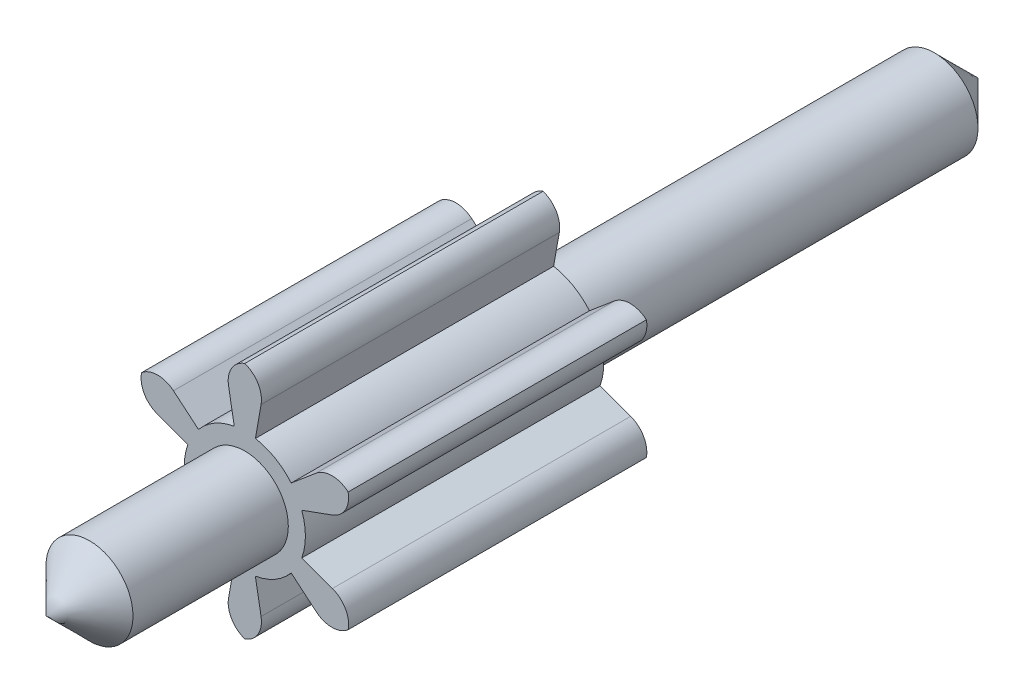
from build123d import *

# Parameters (mm, degrees)
SKETCH2_R                = 0.35
BOSS_EXTRUDE2_DEPTH      = 2.4
BOSS_EXTRUDE3_DEPTH      = 4
BOSS_EXTRUDE3_DEPTH_BACK = 3.5
SKETCH2_2_R              = 0.35
CHAMFER1_SIZE            = 0.35


with BuildPart() as part:
    # Sketch2 → Boss-Extrude2 (new body)
    with BuildSketch(Plane.XY):
        with BuildLine():
            Line((-0.084985286, 0.480035156), (-0.130746593, 0.738515625))
            ThreePointArc((-0.130746593, 0.738515625), (-0.106331255, 0.873436103), (0, 0.96))
            ThreePointArc((0, 0.96), (0.106331255, 0.873436103), (0.130746593, 0.738515625))
            Line((0.130746593, 0.738515625), (0.084985286, 0.480035156))
            ThreePointArc((0.084985286, 0.480035156), (0.24375, 0.422187384), (0.373229997, 0.313616994))
            Line((0.373229997, 0.313616994), (0.574199996, 0.482487684))
            ThreePointArc((0.574199996, 0.482487684), (0.703252226, 0.528803619), (0.831384388, 0.48))
            ThreePointArc((0.831384388, 0.48), (0.809583481, 0.344632483), (0.704946589, 0.256027941))
            Line((0.704946589, 0.256027941), (0.458215283, 0.166418162))
            ThreePointArc((0.458215283, 0.166418162), (0.4875, 0), (0.458215283, -0.166418162))
            Line((0.458215283, -0.166418162), (0.704946589, -0.256027941))
            ThreePointArc((0.704946589, -0.256027941), (0.809583481, -0.344632483), (0.831384388, -0.48))
            ThreePointArc((0.831384388, -0.48), (0.703252226, -0.528803619), (0.574199996, -0.482487684))
            Line((0.574199996, -0.482487684), (0.373229997, -0.313616994))
            ThreePointArc((0.373229997, -0.313616994), (0.24375, -0.422187384), (0.084985286, -0.480035156))
            Line((0.084985286, -0.480035156), (0.130746593, -0.738515625))
            ThreePointArc((0.130746593, -0.738515625), (0.106331255, -0.873436103), (0, -0.96))
            ThreePointArc((0, -0.96), (-0.106331255, -0.873436103), (-0.130746593, -0.738515625))
            Line((-0.130746593, -0.738515625), (-0.084985286, -0.480035156))
            ThreePointArc((-0.084985286, -0.480035156), (-0.24375, -0.422187384), (-0.373229997, -0.313616994))
            Line((-0.373229997, -0.313616994), (-0.574199996, -0.482487684))
            ThreePointArc((-0.574199996, -0.482487684), (-0.703252226, -0.528803619), (-0.831384388, -0.48))
            ThreePointArc((-0.831384388, -0.48), (-0.809583481, -0.344632483), (-0.704946589, -0.256027941))
            Line((-0.704946589, -0.256027941), (-0.458215283, -0.166418162))
            ThreePointArc((-0.458215283, -0.166418162), (-0.4875, 0), (-0.458215283, 0.166418162))
            Line((-0.458215283, 0.166418162), (-0.704946589, 0.256027941))
            ThreePointArc((-0.704946589, 0.256027941), (-0.809583481, 0.344632483), (-0.831384388, 0.48))
            ThreePointArc((-0.831384388, 0.48), (-0.703252226, 0.528803619), (-0.574199996, 0.482487684))
            Line((-0.574199996, 0.482487684), (-0.373229997, 0.313616994))
            ThreePointArc((-0.373229997, 0.313616994), (-0.24375, 0.422187384), (-0.084985286, 0.480035156))
        make_face()
        Circle(SKETCH2_R, mode=Mode.SUBTRACT)
    extrude(amount=BOSS_EXTRUDE2_DEPTH)

    # Sketch2<2> → Boss-Extrude3 (add, two sides: drawn at the far end of the back side and taken through both)
    with BuildSketch(Plane.XY.offset(-BOSS_EXTRUDE3_DEPTH_BACK)):
        Circle(SKETCH2_2_R)
    extrude(amount=BOSS_EXTRUDE3_DEPTH + BOSS_EXTRUDE3_DEPTH_BACK)

    # Chamfer1
    chamfer1_edges = [part.edges().sort_by_distance(p)[0] for p in [
        (-0.35, 0, -3.5),
        (-0.35, 0, 4),
    ]]
    chamfer(chamfer1_edges, length=CHAMFER1_SIZE)


solid = part.part
